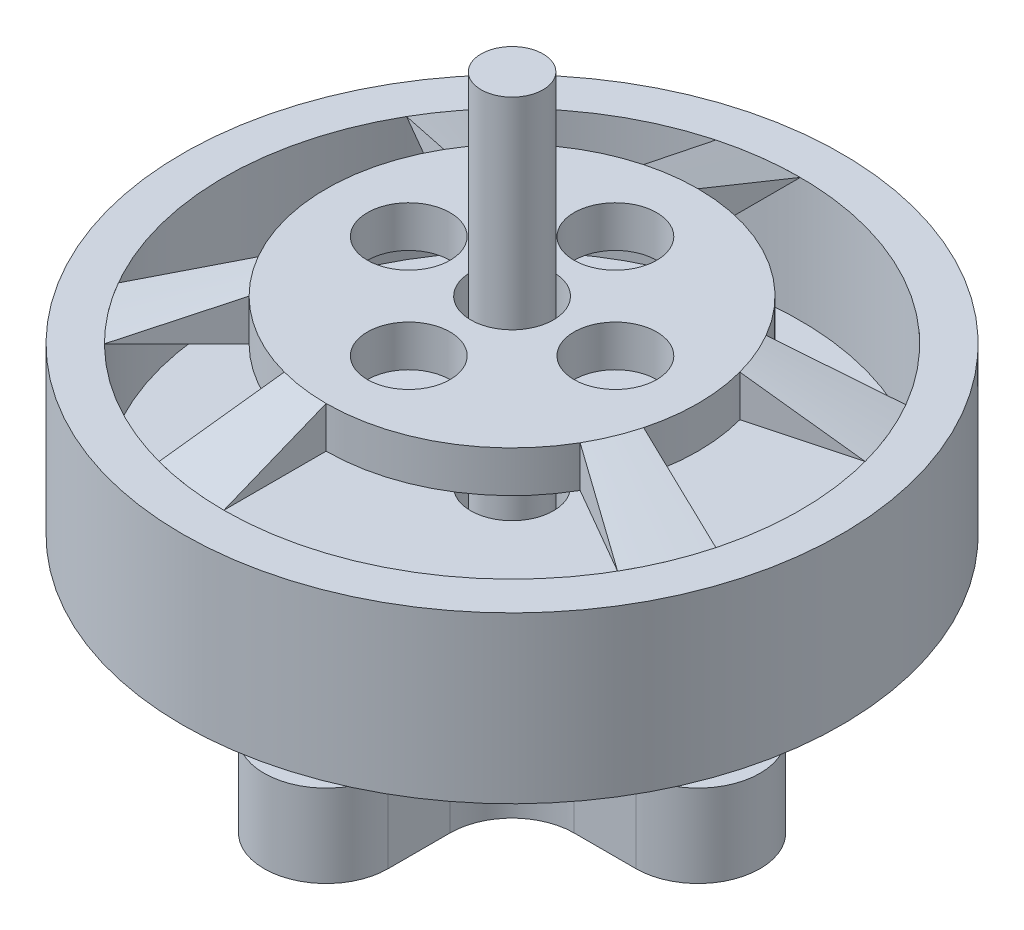
from build123d import *

# Parameters (mm, degrees)
EXTRUDE_1_OUTLINE_R  = 1
EXTRUDE_1_DEPTH      = 2
SKETCH_3_R           = 2
SKETCH_3_R_2         = 1
EXTRUDE_2_DEPTH      = 2
SKETCH_4_R           = 7.975
SKETCH_4_R_2         = 6.975
EXTRUDE_3_DEPTH      = 4
SKETCH_5_R           = 1
EXTRUDE_4_DEPTH      = 1
SKETCH_11_R          = 7.975
SKETCH_11_R_2        = 1
EXTRUDE_5_DEPTH      = 1
EXTRUDE_6_DEPTH      = 13.7
EXTRUDE_6_DEPTH_BACK = 0.2
SKETCH_1_5_R         = 0.75


# Read off the part's stored shape, not the designer's step: 凸台-拉伸1
with BuildPart() as part:
    # 凸台-拉伸1 outline → 凸台-拉伸1 (new body)
    with BuildSketch(Plane(origin=(0, 0, 0), x_dir=(1, 0, 0), z_dir=(0, 1, 0))):
        with BuildLine():
            Line((-3, 1.5), (-4.5, 1.5))
            ThreePointArc((-4.5, 1.5), (-6, 0), (-4.5, -1.5))
            Line((-4.5, -1.5), (-3, -1.5))
            ThreePointArc((-3, -1.5), (-1.939339828, -1.939339828), (-1.5, -3))
            Line((-1.5, -3), (-1.5, -4.5))
            ThreePointArc((-1.5, -4.5), (0, -6), (1.5, -4.5))
            Line((1.5, -4.5), (1.5, -3))
            ThreePointArc((1.5, -3), (1.939339828, -1.939339828), (3, -1.5))
            Line((3, -1.5), (4.5, -1.5))
            ThreePointArc((4.5, -1.5), (6, 0), (4.5, 1.5))
            Line((4.5, 1.5), (3, 1.5))
            ThreePointArc((3, 1.5), (1.939339828, 1.939339828), (1.5, 3))
            Line((1.5, 3), (1.5, 4.5))
            ThreePointArc((1.5, 4.5), (0, 6), (-1.5, 4.5))
            Line((-1.5, 4.5), (-1.5, 3))
            ThreePointArc((-1.5, 3), (-1.939339828, 1.939339828), (-3, 1.5))
        make_face()
        with Locations((0, -4.5)):
            Circle(EXTRUDE_1_OUTLINE_R, mode=Mode.SUBTRACT)
        with Locations((-4.5, 0)):
            Circle(EXTRUDE_1_OUTLINE_R, mode=Mode.SUBTRACT)
        Circle(EXTRUDE_1_OUTLINE_R, mode=Mode.SUBTRACT)
        with Locations((4.5, 0)):
            Circle(EXTRUDE_1_OUTLINE_R, mode=Mode.SUBTRACT)
        with Locations((0, 4.5)):
            Circle(EXTRUDE_1_OUTLINE_R, mode=Mode.SUBTRACT)
    extrude(amount=EXTRUDE_1_DEPTH)

    # 草图3 → 凸台-拉伸2 (add)
    with BuildSketch(Plane(origin=(0, 2, 0), x_dir=(1, 0, 0), z_dir=(0, 1, 0))):
        with Locations(Location((0, 0, 0), (0, 0, 270))):
            Circle(SKETCH_3_R)
        with Locations(Location((0, 0, 0), (0, 0, 270))):
            Circle(SKETCH_3_R_2, mode=Mode.SUBTRACT)
    extrude(amount=EXTRUDE_2_DEPTH)



with BuildPart() as body_2:
    # 草图4 → 凸台-拉伸3 (new body)
    with BuildSketch(Plane(origin=(0, 4, 0), x_dir=(1, 0, 0), z_dir=(0, 1, 0))):
        with Locations(Location((0, 0, 0), (0, 0, 270))):
            Circle(SKETCH_4_R)
        with Locations(Location((0, 0, 0), (0, 0, 270))):
            Circle(SKETCH_4_R_2, mode=Mode.SUBTRACT)
    extrude(amount=EXTRUDE_3_DEPTH)


with BuildPart() as body_3:
    # 草图5 → 凸台-拉伸4 (new body)
    with BuildSketch(Plane(origin=(0, 8, 0), x_dir=(1, 0, 0), z_dir=(0, 1, 0))):
        with BuildLine():
            Line((6.737332638, -1.80526284), (4.346666218, -1.164685703))
            ThreePointArc((4.346666218, -1.164685703), (4.5, 0), (4.346666218, 1.164685703))
            Line((4.346666218, 1.164685703), (6.737332638, 1.80526284))
            ThreePointArc((6.737332638, 1.80526284), (6.444059739, 2.669216941), (6.040527191, 3.4875))
            Line((6.040527191, 3.4875), (3.897114317, 2.25))
            ThreePointArc((3.897114317, 2.25), (2.25, 3.897114317), (0, 4.5))
            Line((0, 4.5), (0, 6.975))
            ThreePointArc((0, 6.975), (-0.910420191, 6.915327908), (-1.80526284, 6.737332638))
            Line((-1.80526284, 6.737332638), (-1.164685703, 4.346666218))
            ThreePointArc((-1.164685703, 4.346666218), (-2.25, 3.897114317), (-3.181980515, 3.181980515))
            Line((-3.181980515, 3.181980515), (-4.932069799, 4.932069799))
            ThreePointArc((-4.932069799, 4.932069799), (-5.533639549, 4.246110967), (-6.040527191, 3.4875))
            Line((-6.040527191, 3.4875), (-3.897114317, 2.25))
            ThreePointArc((-3.897114317, 2.25), (-4.5, 0), (-3.897114317, -2.25))
            Line((-3.897114317, -2.25), (-6.040527191, -3.4875))
            ThreePointArc((-6.040527191, -3.4875), (-5.533639549, -4.246110967), (-4.932069799, -4.932069799))
            Line((-4.932069799, -4.932069799), (-3.181980515, -3.181980515))
            ThreePointArc((-3.181980515, -3.181980515), (-2.25, -3.897114317), (-1.164685703, -4.346666218))
            Line((-1.164685703, -4.346666218), (-1.80526284, -6.737332638))
            ThreePointArc((-1.80526284, -6.737332638), (-0.910420191, -6.915327908), (0, -6.975))
            Line((0, -6.975), (0, -4.5))
            ThreePointArc((0, -4.5), (2.25, -3.897114317), (3.897114317, -2.25))
            Line((3.897114317, -2.25), (6.040527191, -3.4875))
            ThreePointArc((6.040527191, -3.4875), (6.444059739, -2.669216941), (6.737332638, -1.80526284))
        make_face()
        with Locations(Location((0, 2.5, 0), (0, 0, 270))):
            Circle(SKETCH_5_R, mode=Mode.SUBTRACT)
        with Locations(Location((0, -2.5, 0), (0, 0, 270))):
            Circle(SKETCH_5_R, mode=Mode.SUBTRACT)
        with Locations(Location((-2.5, 0, 0), (0, 0, 270))):
            Circle(SKETCH_5_R, mode=Mode.SUBTRACT)
        with Locations(Location((0, 0, 0), (0, 0, 270))):
            Circle(SKETCH_5_R, mode=Mode.SUBTRACT)
        with Locations(Location((2.5, 0, 0), (0, 0, 270))):
            Circle(SKETCH_5_R, mode=Mode.SUBTRACT)
    extrude(amount=EXTRUDE_4_DEPTH)

    # 草图7 → 切除-旋转2 (revolve, cut)
    with BuildSketch(Plane(origin=(0, 0, 0), x_dir=(0.8660254037844349, 0, 0.5000000000000067), z_dir=(-0.5000000000000066, 0, 0.8660254037844348)), mode=Mode.PRIVATE) as cut_revolve_2_sk:
        Polygon((-4.5, 9), (-6.975, 8), (-6.975, 9), align=None)
    revolve(cut_revolve_2_sk.sketch.rotate(Axis((0, 0, 0), (0, 1, 0)), 120), axis=Axis((0, 0, 0), (0, 1, 0)), mode=Mode.SUBTRACT)


with BuildPart() as part_1:
    add(part.part)

    add(body_2.part)  # 凸台-拉伸5 merges body 2
    # 草图11 → 凸台-拉伸5 (add)
    with BuildSketch(Plane(origin=(0, 4, 0), x_dir=(1, 0, 0), z_dir=(0, 1, 0))):
        with Locations(Location((0, 0, 0), (0, 0, 270))):
            Circle(SKETCH_11_R)
        with Locations(Location((0, 0, 0), (0, 0, 270))):
            Circle(SKETCH_11_R_2, mode=Mode.SUBTRACT)
    extrude(amount=EXTRUDE_5_DEPTH)


with BuildPart() as body_3_2:
    # 草图1<5> → 凸台-拉伸6 (new, two sides: drawn at the far end of the back side and taken through both)
    with BuildSketch(Plane(origin=(0, 0, 0), x_dir=(1, 0, 0), z_dir=(0, 1, 0)).offset(-EXTRUDE_6_DEPTH_BACK)):
        with Locations(Location((0, 0, 0), (0, 0, 270))):
            Circle(SKETCH_1_5_R)
    extrude(amount=EXTRUDE_6_DEPTH + EXTRUDE_6_DEPTH_BACK)


solid = Compound([body_3.part, part_1.part, body_3_2.part])
